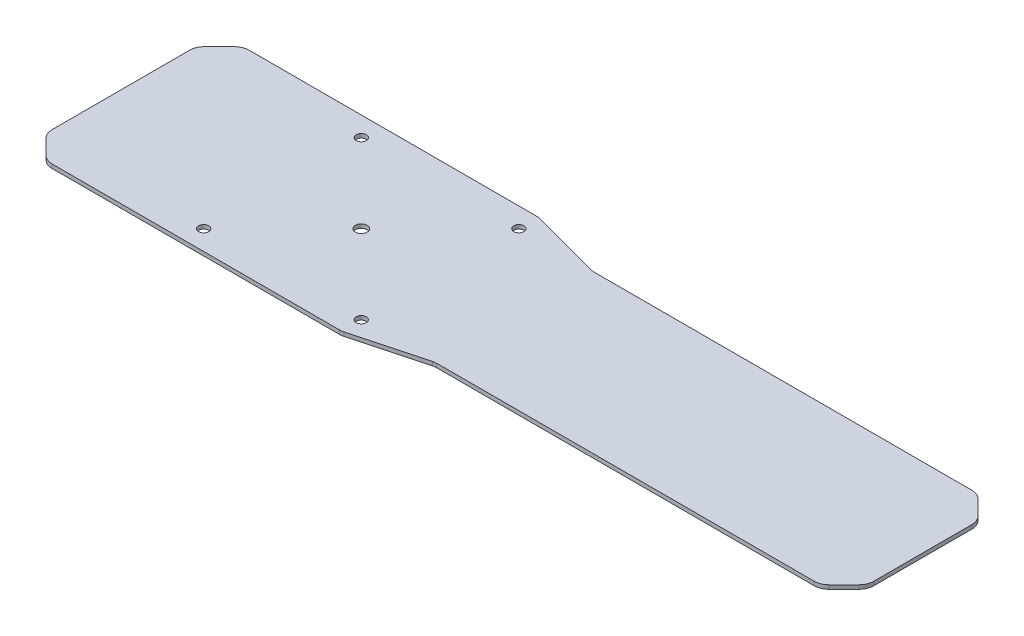
from build123d import *

# Parameters (mm, degrees)
BOSS_EXTRUDE2_DEPTH = 2
CHAMFER2_SIZE       = 12
FILLET1_R           = 7.5
SKETCH2_R           = 2.575
SKETCH2_R_2         = 3
CUT_EXTRUDE1_DEPTH  = 290.359637821


with BuildPart() as part:
    # Sketch1 → Boss-Extrude2 (new body)
    with BuildSketch(Plane(origin=(0, 0, 0), x_dir=(1, 0, 0), z_dir=(0, 1, 0))):
        Polygon((40, -50), (77.320508076, -40), (285, -40), (285, 40), (77.320508076, 40), (40, 50), (-40, 50), (-122, 50), (-122, -50), (-40, -50), align=None)
    extrude(amount=BOSS_EXTRUDE2_DEPTH)

    # Chamfer2
    chamfer2_edges = [part.edges().sort_by_distance(p)[0] for p in [
        (-122, 1, 50),
        (-122, 1, -50),
        (285, 1, -40),
        (285, 1, 40),
    ]]
    chamfer(chamfer2_edges, length=CHAMFER2_SIZE)

    # Fillet1
    fillet1_edges = [part.edges().sort_by_distance(p)[0] for p in [
        (-110, 1, -50),
        (-122, 1, -38),
        (-122, 1, 38),
        (-110, 1, 50),
        (273, 1, 40),
        (285, 1, 28),
        (285, 1, -28),
        (273, 1, -40),
        (40, 1, 50),
        (77.320508076, 1, 40),
        (77.320508076, 1, -40),
        (40, 1, -50),
    ]]
    fillet(fillet1_edges, radius=FILLET1_R)

    # Sketch2 → Cut-Extrude1 (cut, through all)
    with BuildSketch(Plane(origin=(0, 2, 0), x_dir=(1, 0, 0), z_dir=(0, 1, 0))):
        with Locations((-40, 40)):
            Circle(SKETCH2_R)
        with Locations((40, 40)):
            Circle(SKETCH2_R)
        with Locations((40, -40)):
            Circle(SKETCH2_R)
        with Locations((-40, -40)):
            Circle(SKETCH2_R)
        Circle(SKETCH2_R_2)
    extrude(amount=-CUT_EXTRUDE1_DEPTH, mode=Mode.SUBTRACT)


solid = part.part
